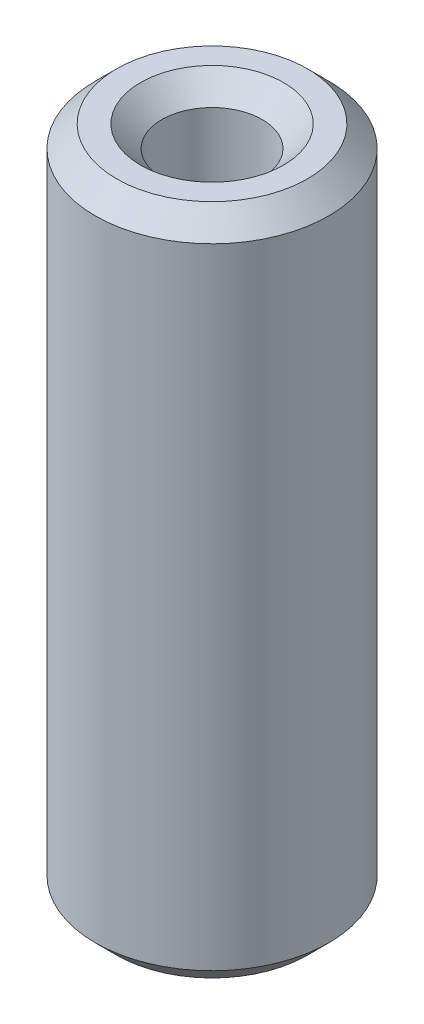
from build123d import *

# Parameters (mm, degrees)
SKETCH1_R           = 17.5
BOSS_EXTRUDE1_DEPTH = 100.765719705
SKETCH2_R           = 7.52300881
CUT_EXTRUDE1_DEPTH  = 104.760446547
CHAMFER1_SIZE       = 3.201817053


with BuildPart() as part:
    # Sketch1 → Boss-Extrude1 (new body)
    with BuildSketch(Plane(origin=(0, 0, 0), x_dir=(1, 0, 0), z_dir=(0, 1, 0))):
        Circle(SKETCH1_R)
    extrude(amount=BOSS_EXTRUDE1_DEPTH)

    # Sketch2 → Cut-Extrude1 (cut, through all)
    with BuildSketch(Plane(origin=(0, 0, 0), x_dir=(1, 0, 0), z_dir=(0, 1, 0))):
        Circle(SKETCH2_R)
    extrude(amount=CUT_EXTRUDE1_DEPTH, mode=Mode.SUBTRACT)

    # Chamfer1
    chamfer1_edges = [part.edges().sort_by_distance(p)[0] for p in [
        (-7.52300881, 100.765719705, 0),
        (-7.52300881, 0, 0),
        (-17.5, 0, 0),
        (-17.5, 100.765719705, 0),
    ]]
    chamfer(chamfer1_edges, length=CHAMFER1_SIZE)


solid = part.part
